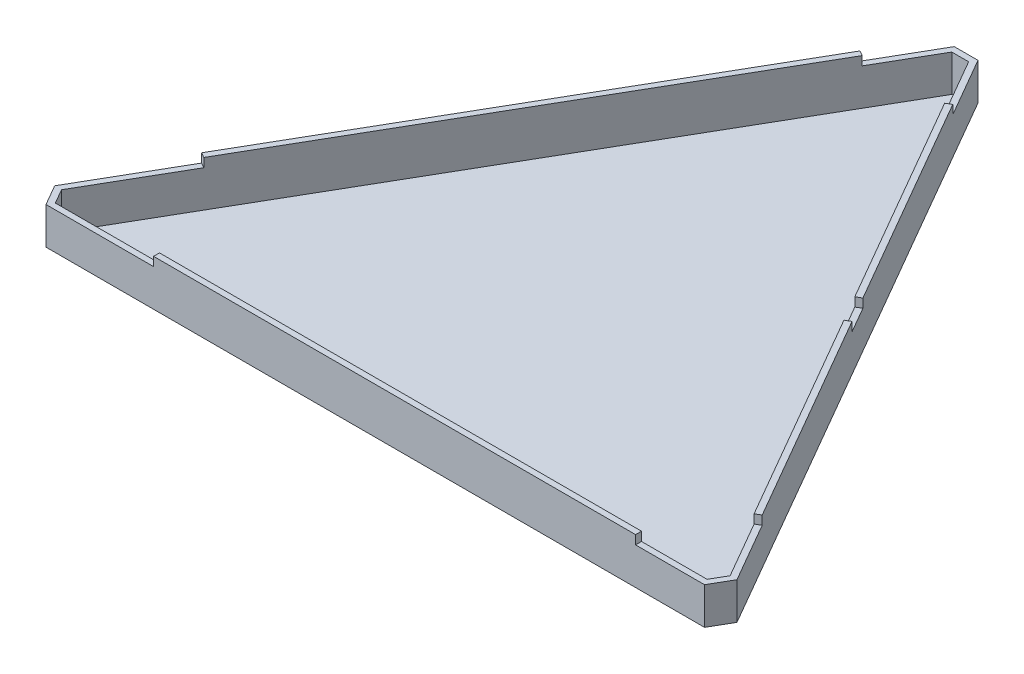
from build123d import *

# Parameters (mm, degrees)
BOSS_EXTRUDE1_DEPTH = 0.08
BOSS_EXTRUDE2_DEPTH = 12.46
SKETCH1_4_W         = 162.49
SKETCH1_4_H         = 2
BOSS_EXTRUDE3_DEPTH = 15.46


# Read off the part's stored shape, not the designer's step: Boss-Extrude2
with BuildPart() as part:
    # Sketch1 → Boss-Extrude1 (new body)
    with BuildSketch(Plane(origin=(0, 0, 0), x_dir=(1, 0, 0), z_dir=(0, 1, 0))):
        Polygon((-115, 0), (-111, -6.92820323), (111, -6.92820323), (115, 0), (15.625, 172.122549002), (13.892949192, 171.122549002), (2.845299462, 190.25763964), (-2.845299462, 190.25763964), (-13.892949192, 171.122549002), (-15.625, 172.122549002), align=None)
    extrude(amount=BOSS_EXTRUDE1_DEPTH)

    # Boss-Extrude2 outline → Boss-Extrude2 (add)
    with BuildSketch(Plane(origin=(0, 0, 0), x_dir=(1, 0, 0), z_dir=(0, 1, 0))):
        Polygon((15.625, 172.122549002), (4, 192.25763964), (-4, 192.25763964), (-15.625, 172.122549002), (-13.892949192, 171.122549002), (-2.845299462, 190.25763964), (2.845299462, 190.25763964), (13.892949192, 171.122549002), align=None)
        Polygon((62, 91.798692801), (57, 100.458946839), (55.267949192, 99.458946839), (60.267949192, 90.798692801), align=None)
        Polygon((-95.137949192, 30.402081141), (-96.87, 31.402081141), (-115, 0), (-111, -6.92820323), (-74.74, -6.92820323), (-74.74, -4.92820323), (-109.845299462, -4.92820323), (-112.690598923, 0), align=None)
        Polygon((115, 0), (103.375, 20.135090638), (101.642949192, 19.135090638), (112.690598923, 0), (109.845299462, -4.92820323), (87.75, -4.92820323), (87.75, -6.92820323), (111, -6.92820323), align=None)
    extrude(amount=BOSS_EXTRUDE2_DEPTH)

    # Sketch1<4> → Boss-Extrude3 (add)
    with BuildSketch(Plane(origin=(0, 0, 0), x_dir=(1, 0, 0), z_dir=(0, 1, 0))):
        Polygon((-15.625, 172.122549002), (-96.87, 31.402081141), (-95.137949192, 30.402081141), (-13.892949192, 171.122549002), align=None)
        with Locations((6.505, -5.92820323)):
            Rectangle(SKETCH1_4_W, SKETCH1_4_H)
        Polygon((57, 100.458946839), (15.625, 172.122549002), (13.892949192, 171.122549002), (55.267949192, 99.458946839), align=None)
        Polygon((101.642949192, 19.135090638), (103.375, 20.135090638), (62, 91.798692801), (60.267949192, 90.798692801), align=None)
    extrude(amount=BOSS_EXTRUDE3_DEPTH)


solid = part.part
